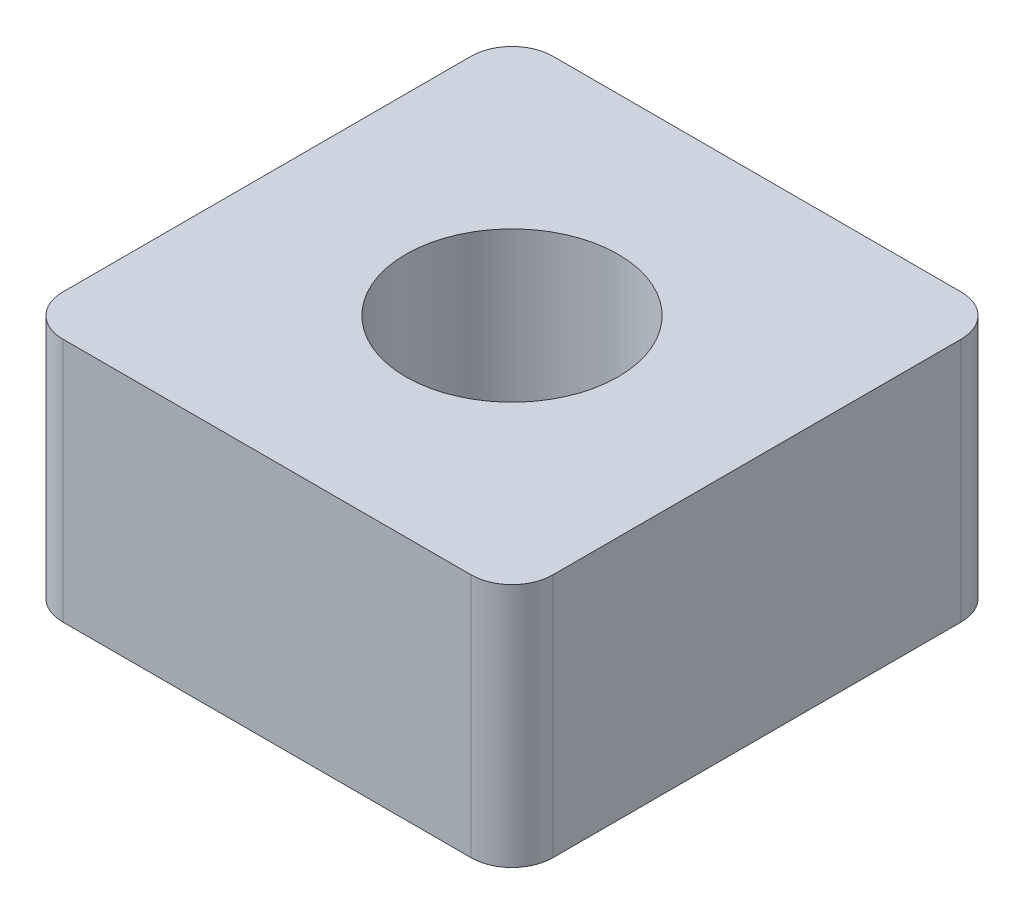
from build123d import *

# Parameters (mm, degrees)
SKETCH1_R           = 2.6
BOSS_EXTRUDE1_DEPTH = 6


with BuildPart() as part:
    # Sketch1 → Boss-Extrude1 (new body)
    with BuildSketch(Plane(origin=(0, 0, 0), x_dir=(1, 0, 0), z_dir=(0, 1, 0))):
        with BuildLine():
            Line((-5, 6), (5, 6))
            ThreePointArc((5, 6), (5.707106781, 5.707106781), (6, 5))
            Line((6, 5), (6, -5))
            ThreePointArc((6, -5), (5.707106781, -5.707106781), (5, -6))
            Line((5, -6), (-5, -6))
            ThreePointArc((-5, -6), (-5.707106781, -5.707106781), (-6, -5))
            Line((-6, -5), (-6, 5))
            ThreePointArc((-6, 5), (-5.707106781, 5.707106781), (-5, 6))
        make_face()
        Circle(SKETCH1_R, mode=Mode.SUBTRACT)
    extrude(amount=BOSS_EXTRUDE1_DEPTH)


solid = part.part
